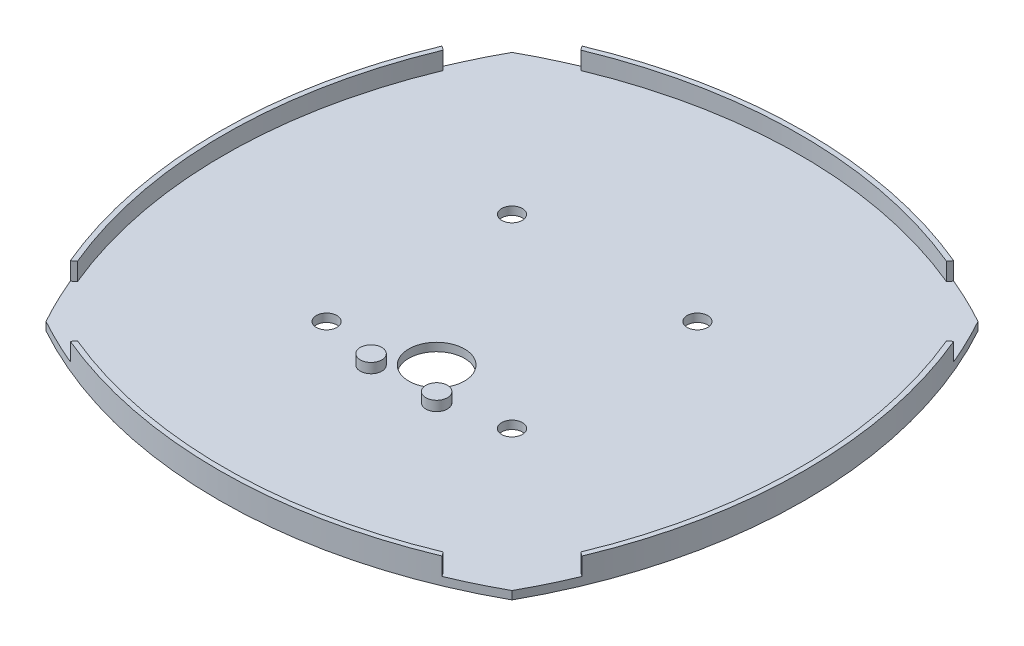
from build123d import *

# Parameters (mm, degrees)
BOSS_EXTRUDE1_DEPTH     = 2.5
BOSS_EXTRUDE2_DEPTH     = 5.4
CUT_EXTRUDE2_DEPTH      = 322.973340243
CUT_EXTRUDE2_DEPTH_BACK = 322.973340243
SKETCH11_R              = 3.15
SKETCH11_R_2            = 8.5
SKETCH13_R              = 3.289472506
BOSS_EXTRUDE3_DEPTH     = 3


with BuildPart() as part:
    # Sketch3 → Boss-Extrude1 (new body)
    with BuildSketch(Plane(origin=(0, 0, 0), x_dir=(1, 0, 0), z_dir=(0, 1, 0))):
        with BuildLine():
            ThreePointArc((270.417889247, 18.185515407), (199.331937646, 36.525228411), (128.245986044, 18.185515407))
            ThreePointArc((128.245986044, 18.185515407), (109.90627304, -52.900436194), (128.245986044, -123.986387796))
            ThreePointArc((128.245986044, -123.986387796), (199.331937646, -142.3261008), (270.417889247, -123.986387796))
            ThreePointArc((270.417889247, -123.986387796), (288.757602252, -52.900436194), (270.417889247, 18.185515407))
        make_face()
    extrude(amount=BOSS_EXTRUDE1_DEPTH)

    # Sketch5 → Boss-Extrude2 (add)
    with BuildSketch(Plane(origin=(0, 2.5, 0), x_dir=(1, 0, 0), z_dir=(0, 1, 0))):
        with BuildLine():
            Line((122.535046213, -108.696643839), (121.287713046, -109.602884431))
            ThreePointArc((121.287713046, -109.602884431), (109.90627304, -52.900436194), (121.287713046, 3.802012043))
            Line((121.287713046, 3.802012043), (122.535046213, 2.89577145))
            ThreePointArc((122.535046213, 2.89577145), (111.40627304, -52.900436194), (122.535046213, -108.696643839))
        make_face()
        with BuildLine():
            Line((143.535730001, -129.697327627), (142.629489409, -130.944660794))
            ThreePointArc((142.629489409, -130.944660794), (199.331937646, -142.3261008), (256.034385883, -130.944660794))
            Line((256.034385883, -130.944660794), (255.128145291, -129.697327627))
            ThreePointArc((255.128145291, -129.697327627), (199.331937646, -140.8261008), (143.535730001, -129.697327627))
        make_face()
        with BuildLine():
            Line((276.128829079, 2.89577145), (277.376162246, 3.802012043))
            ThreePointArc((277.376162246, 3.802012043), (288.757602252, -52.900436194), (277.376162246, -109.602884431))
            Line((277.376162246, -109.602884431), (276.128829079, -108.696643839))
            ThreePointArc((276.128829079, -108.696643839), (287.257602252, -52.900436194), (276.128829079, 2.89577145))
        make_face()
        with BuildLine():
            Line((255.128145291, 23.896455239), (256.034385883, 25.143788405))
            ThreePointArc((256.034385883, 25.143788405), (199.331937646, 36.525228411), (142.629489409, 25.143788405))
            Line((142.629489409, 25.143788405), (143.535730001, 23.896455239))
            ThreePointArc((143.535730001, 23.896455239), (199.331937646, 35.025228411), (255.128145291, 23.896455239))
        make_face()
    extrude(amount=BOSS_EXTRUDE2_DEPTH)

    # Sketch11 → Cut-Extrude2 (cut, two sides: drawn at the far end of the back side and taken through both)
    with BuildSketch(Plane(origin=(0, 2.5, 0), x_dir=(1, 0, 0), z_dir=(0, 1, 0)).offset(-CUT_EXTRUDE2_DEPTH_BACK)):
        with Locations((171.047666398, -24.616164947)):
            Circle(SKETCH11_R)
        with Locations((227.616208893, -24.616164947)):
            Circle(SKETCH11_R)
        with Locations((227.616208893, -81.184707442)):
            Circle(SKETCH11_R)
        with Locations((171.047666398, -81.184707442)):
            Circle(SKETCH11_R)
        with Locations((199.331937646, -75.900436194)):
            Circle(SKETCH11_R_2)
    extrude(amount=CUT_EXTRUDE2_DEPTH + CUT_EXTRUDE2_DEPTH_BACK, mode=Mode.SUBTRACT)

    # Sketch13 → Boss-Extrude3 (add)
    with BuildSketch(Plane(origin=(0, 2.5, 0), x_dir=(1, 0, 0), z_dir=(0, 1, 0))):
        with Locations((189.331937646, -85.900436194)):
            Circle(SKETCH13_R)
        with Locations((209.331937646, -85.900436194)):
            Circle(SKETCH13_R)
    extrude(amount=BOSS_EXTRUDE3_DEPTH)


solid = part.part
